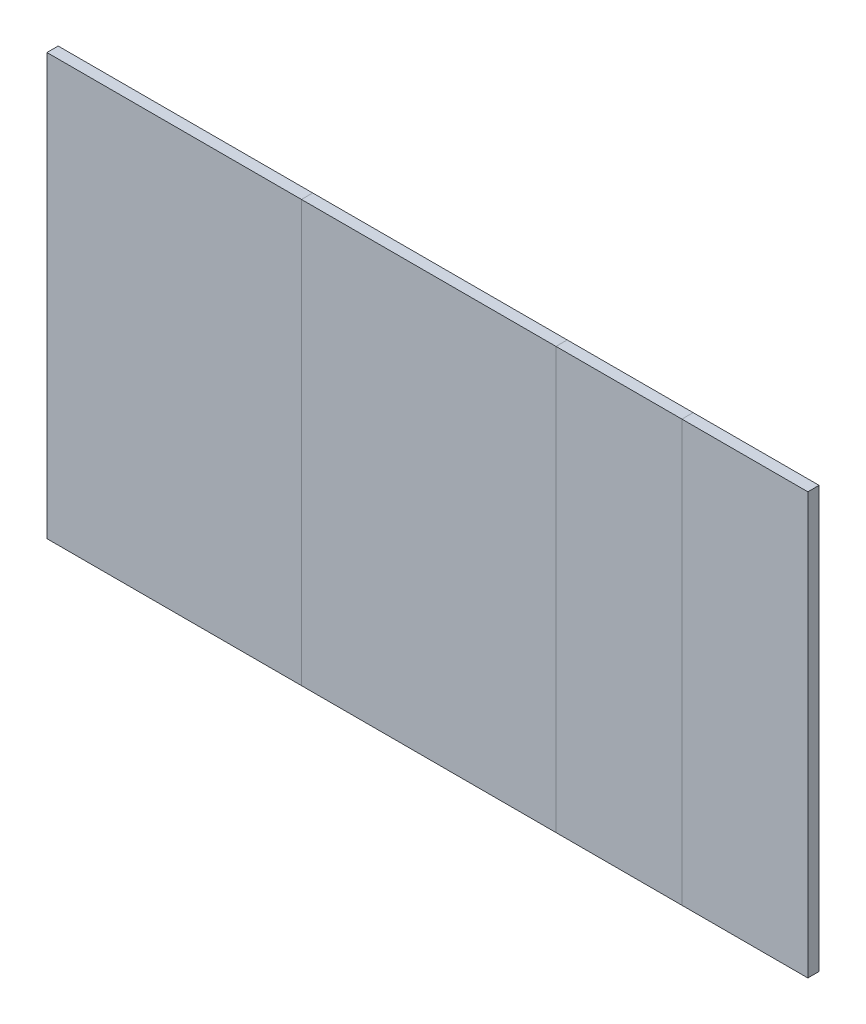
from build123d import *

# Parameters (mm, degrees)
SKETCH1_W           = 1290.828
SKETCH1_H           = 714.2734
BOSS_EXTRUDE1_DEPTH = 19.05
SPLIT3_OUTLINE_W    = 714.2734
SPLIT3_OUTLINE_H    = 19.05
SPLIT3_DEPTH        = 431.8
SPLIT3_2_OUTLINE_W  = 714.2734
SPLIT3_2_OUTLINE_H  = 19.05
SPLIT3_2_DEPTH      = 431.8
SPLIT3_START        = 863.6
SPLIT3_3_OUTLINE_W  = 714.2734
SPLIT3_3_OUTLINE_H  = 19.05
SPLIT3_3_DEPTH      = 427.228
SPLIT3_4_OUTLINE_W  = 714.2734
SPLIT3_4_OUTLINE_H  = 19.05
SPLIT3_4_DEPTH      = 427.228


# Read off the part's stored shape, not the designer's step: Split3
with BuildPart() as part:
    # Sketch1 → Boss-Extrude1 (new body)
    with BuildSketch(Plane.XY):
        with Locations((645.414, 357.1367)):
            Rectangle(SKETCH1_W, SKETCH1_H)
    extrude(amount=BOSS_EXTRUDE1_DEPTH)

    # Split3 2 outline → Split3 2 (cut)
    with BuildSketch(Plane.YZ):
        with Locations((357.1367, 9.525)):
            Rectangle(SPLIT3_2_OUTLINE_W, SPLIT3_2_OUTLINE_H)
    extrude(amount=SPLIT3_2_DEPTH, mode=Mode.SUBTRACT)

    # Split3 3 outline → Split3 3 (cut)
    with BuildSketch(Plane.YZ.offset(SPLIT3_START)):
        with Locations((357.1367, 9.525)):
            Rectangle(SPLIT3_3_OUTLINE_W, SPLIT3_3_OUTLINE_H)
    extrude(amount=SPLIT3_3_DEPTH, mode=Mode.SUBTRACT)


with BuildPart() as body_2:
    # Split3 outline → Split3 (new body)
    with BuildSketch(Plane.YZ):
        with Locations((357.1367, 9.525)):
            Rectangle(SPLIT3_OUTLINE_W, SPLIT3_OUTLINE_H)
    extrude(amount=SPLIT3_DEPTH)


with BuildPart() as body_3:
    # Split3 4 outline → Split3 4 (new body)
    with BuildSketch(Plane.YZ.offset(SPLIT3_START)):
        with Locations((357.1367, 9.525)):
            Rectangle(SPLIT3_4_OUTLINE_W, SPLIT3_4_OUTLINE_H)
    extrude(amount=SPLIT3_4_DEPTH)


with BuildPart() as body_4:
    # Split4: the piece on the far side of the plane
    add(body_3.part)
    split(bisect_by=Plane(origin=(1077.214, 0, 0), x_dir=(0, 0, 1), z_dir=(1, 0, 0)), keep=Keep.BOTTOM)


with BuildPart() as body_3_1:
    add(body_3.part)

    # Split4
    split(bisect_by=Plane(origin=(1077.214, 0, 0), x_dir=(0, 0, 1), z_dir=(1, 0, 0)), keep=Keep.TOP)


solid = Compound([part.part, body_2.part, body_4.part, body_3_1.part])
